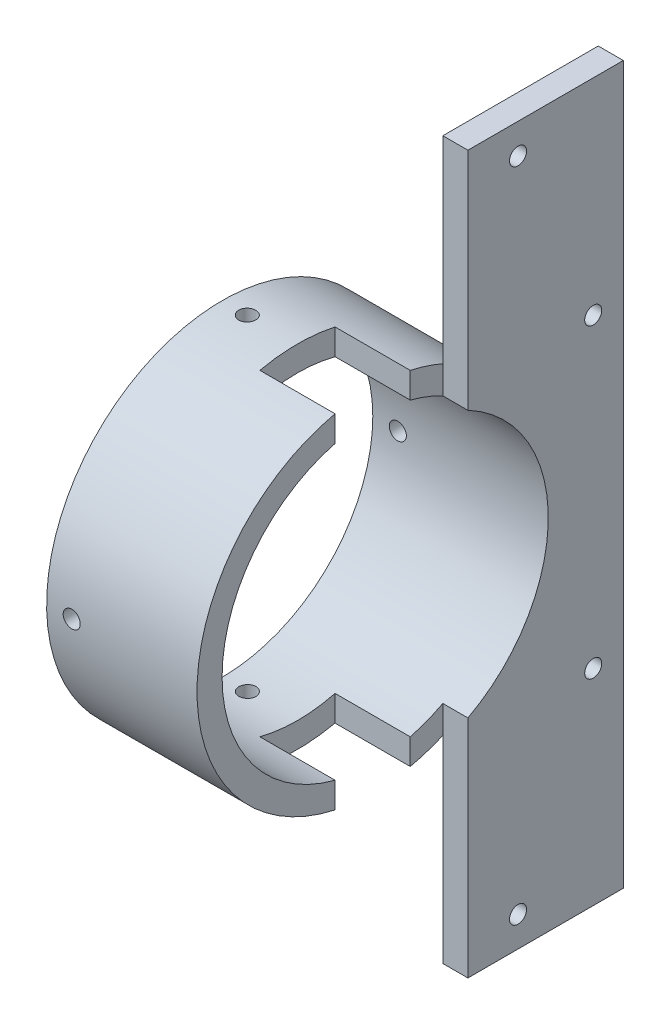
from build123d import *

# Parameters (mm, degrees)
SKETCH1_R            = 35.03125
SKETCH1_R_2          = 30.03125
BOSS_EXTRUDE1_DEPTH  = 30
M3_CLEARANCE_HOLE2_D = 3.4
M3_CLEARANCE_HOLE3_D = 3.4
BOSS_EXTRUDE2_DEPTH  = 5
M3_CLEARANCE_HOLE4_D = 3.4
SKETCH14_W           = 15
SKETCH14_H           = 123.928098147
CUT_EXTRUDE1_DEPTH   = 15


with BuildPart() as part:
    # Sketch1 → Boss-Extrude1 (new body)
    with BuildSketch(Plane(origin=(0, 0, 0), x_dir=(0, 0, -1), z_dir=(1, 0, 0))):
        Circle(SKETCH1_R)
        Circle(SKETCH1_R_2, mode=Mode.SUBTRACT)
    extrude(amount=BOSS_EXTRUDE1_DEPTH)

    # M3 Clearance Hole2 (through all)
    with Locations(Plane(origin=(0, 35.03125, 0), x_dir=(1, 0, 0), z_dir=(0, 1, 0))):
        with Locations((5, 0)):
            Hole(M3_CLEARANCE_HOLE2_D / 2)

    # M3 Clearance Hole3 (through all)
    with Locations(Plane.XY.offset(35.03125)):
        with Locations((5, 0)):
            Hole(M3_CLEARANCE_HOLE3_D / 2)

    # Sketch9 → Boss-Extrude2 (add)
    with BuildSketch(Plane(origin=(30, 0, 0), x_dir=(0, 0, -1), z_dir=(1, 0, 0))):
        with BuildLine():
            Line((14, 71.5), (45, 71.5))
            Line((45, 71.5), (45, -71.5))
            Line((45, -71.5), (14, -71.5))
            Line((14, -71.5), (14, -26.568326567))
            ThreePointArc((14, -26.568326567), (30.03125, 0), (14, 26.568326567))
            Line((14, 26.568326567), (14, 71.5))
        make_face()
    extrude(amount=BOSS_EXTRUDE2_DEPTH)

    # M3 Clearance Hole4 (through all)
    with Locations(Plane(origin=(35, 0, 0), x_dir=(0, 0, -1), z_dir=(1, 0, 0))):
        with Locations((39, 30.5), (24, 65.5), (24, -65.5), (39, -30.5)):
            Hole(M3_CLEARANCE_HOLE4_D / 2)

    # Sketch14 → Cut-Extrude1 (cut)
    with BuildSketch(Plane(origin=(30, 0, 0), x_dir=(0, 0, -1), z_dir=(1, 0, 0))):
        with Locations((0, 15.044796635)):
            Rectangle(SKETCH14_W, SKETCH14_H)
    extrude(amount=-CUT_EXTRUDE1_DEPTH, mode=Mode.SUBTRACT)


solid = part.part
